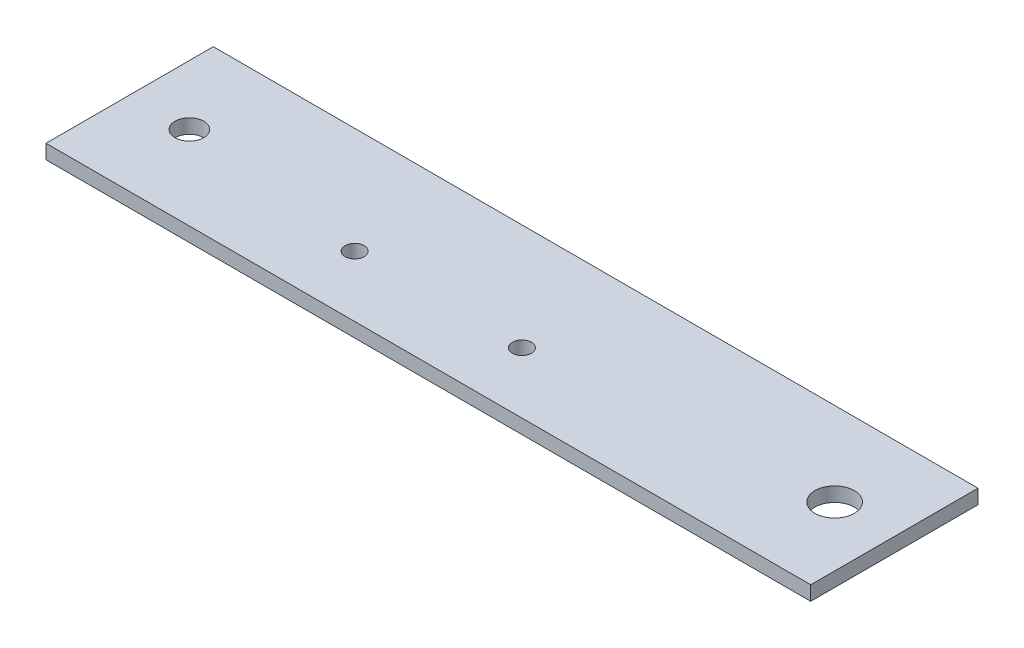
from build123d import *

# Parameters (mm, degrees)
SKETCH1_W           = 160
SKETCH1_H           = 35
SKETCH1_R           = 2
SKETCH1_R_2         = 4.125
BOSS_EXTRUDE1_DEPTH = 3
SKETCH2_R           = 3
CUT_EXTRUDE1_DEPTH  = 82.946628973


with BuildPart() as part:
    # Sketch1 → Boss-Extrude1 (new body)
    with BuildSketch(Plane(origin=(0, 0, 0), x_dir=(1, 0, 0), z_dir=(0, 1, 0))):
        Rectangle(SKETCH1_W, SKETCH1_H)
        with Locations((-28.158485727, -4.763382536)):
            Circle(SKETCH1_R, mode=Mode.SUBTRACT)
        with Locations((6.841514273, -4.763382536)):
            Circle(SKETCH1_R, mode=Mode.SUBTRACT)
        with Locations((67.5, 0)):
            Circle(SKETCH1_R_2, mode=Mode.SUBTRACT)
    extrude(amount=BOSS_EXTRUDE1_DEPTH)

    # Sketch2 → Cut-Extrude1 (cut, through all)
    with BuildSketch(Plane(origin=(0, 3, 0), x_dir=(1, 0, 0), z_dir=(0, 1, 0))):
        with Locations((-67.5, 0)):
            Circle(SKETCH2_R)
    extrude(amount=-CUT_EXTRUDE1_DEPTH, mode=Mode.SUBTRACT)


solid = part.part
